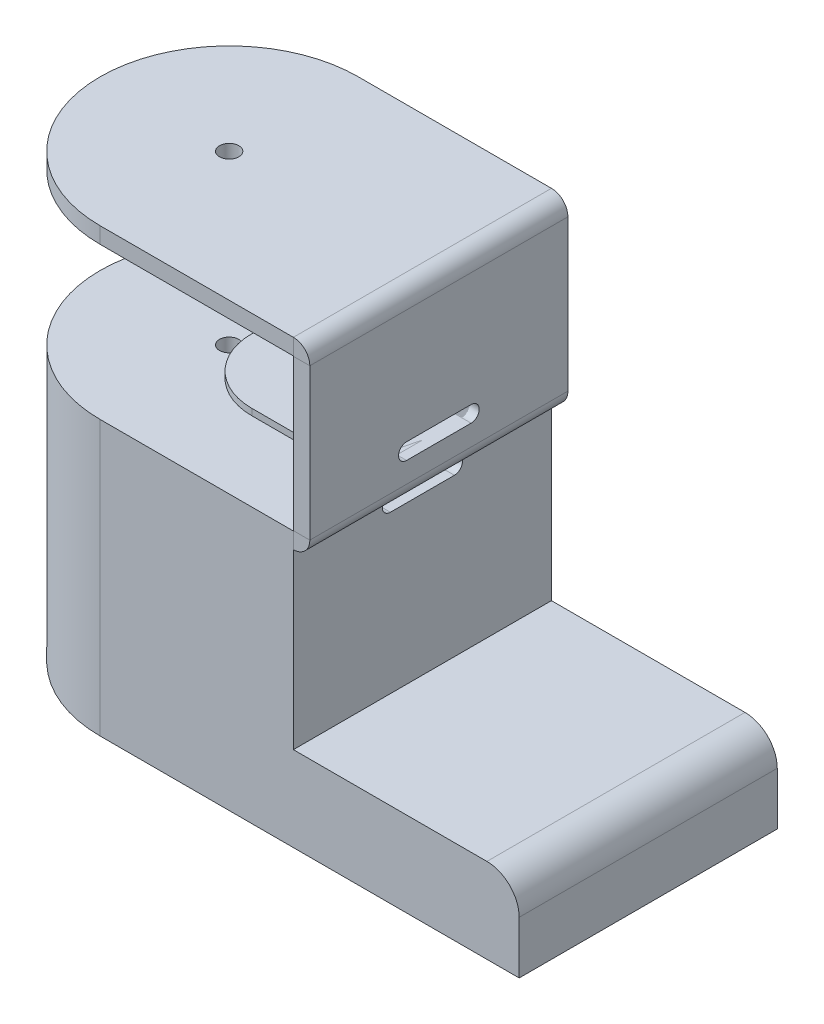
from build123d import *

# Parameters (mm, degrees)
BASE_FLANGE1_DEPTH      = 40
BASE_FLANGE2_DEPTH      = 20
FILLET1_R               = 20
FILLET2_R               = 40
SKETCH10_R              = 3
CUT_EXTRUDE1_DEPTH      = 122.856472951
CUT_EXTRUDE2_DEPTH      = 117.726175299
CUT_EXTRUDE2_DEPTH_BACK = 117.726175299
SKETCH13_R              = 5
EXTRUDE_THIN1_DEPTH     = 80
SKETCH15_R              = 1
CUT_EXTRUDE3_DEPTH      = 5
CUT_EXTRUDE4_START      = -11.1
CUT_EXTRUDE4_DEPTH      = 6
CUT_EXTRUDE4_START_2    = -5
CUT_EXTRUDE4_2_DEPTH    = 5
SKETCH18_W              = 68
SKETCH18_H              = 20
CUT_EXTRUDE5_DEPTH      = 6
BOSS_EXTRUDE1_DEPTH     = 70
SKETCH20_W              = 6
SKETCH20_H              = 68
BOSS_EXTRUDE2_DEPTH     = 20
FILLET3_R               = 10


# Read off the part's stored shape, not the designer's step: Cut-Extrude4
# Sheet-metal steps are written as plain solids
with BuildPart() as part:
    # Sketch2 → Base-Flange1 (new, symmetric)
    with BuildSketch(Plane.XY):
        with BuildLine():
            Line((-100, 47), (-0.1, 47))
            ThreePointArc((-0.1, 47), (-0.029289322, 46.970710678), (0, 46.9))
            Line((0, 46.9), (0, 0.1))
            ThreePointArc((0, 0.1), (-0.029289322, 0.029289322), (-0.1, 0))
            Line((-0.1, 0), (-100, 0))
            Line((-100, 0), (-100, -5))
            Line((-100, -5), (-0.1, -5))
            ThreePointArc((-0.1, -5), (3.506244584, -3.506244584), (5, 0.1))
            Line((5, 0.1), (5, 46.9))
            ThreePointArc((5, 46.9), (3.506244584, 50.506244584), (-0.1, 52))
            Line((-0.1, 52), (-100, 52))
            Line((-100, 52), (-100, 47))
        make_face()
    extrude(amount=BASE_FLANGE1_DEPTH, both=True)

    # Fillet2
    fillet2_edges = [part.edges().sort_by_distance(p)[0] for p in [
        (-100, -2.5, 40),
        (-100, -2.5, -40),
        (-100, 49.5, -40),
        (-100, 49.5, 40),
    ]]
    fillet(fillet2_edges, radius=FILLET2_R - 0.0001)  # a hair under: the kernel refuses the full size

    # Sketch10 → Cut-Extrude1 (cut, through all)
    with BuildSketch(Plane(origin=(0, 52, 0), x_dir=(1, 0, 0), z_dir=(0, 1, 0))):
        with Locations(Location((-60, 0, 0), (0, 0, 180))):
            Circle(SKETCH10_R)
    extrude(amount=-CUT_EXTRUDE1_DEPTH, mode=Mode.SUBTRACT)

    # Sketch14 → Extrude-Thin1 (add)
    with BuildSketch(Plane.XZ.offset(5)):
        with BuildLine():
            Line((-60, 40), (-0.1, 40))
            Line((-0.1, 40), (-0.1, -40))
            Line((-0.1, -40), (-60, -40))
            ThreePointArc((-60, -40), (-100, 0), (-60, 40))
        make_face()
        with BuildLine():
            Line((-60, 34), (-6.1, 34))
            Line((-6.1, 34), (-6.1, -34))
            Line((-6.1, -34), (-60, -34))
            ThreePointArc((-60, -34), (-94, 0), (-60, 34))
        make_face(mode=Mode.SUBTRACT)
    extrude(amount=EXTRUDE_THIN1_DEPTH)

    # Sketch15 → Cut-Extrude3 (cut)
    with BuildSketch(Plane(origin=(0, 0, 0), x_dir=(1, 0, 0), z_dir=(0, 1, 0))):
        with Locations(Location((-33, 0, 0), (0, 0, 180))):
            Circle(SKETCH15_R)
    extrude(amount=-CUT_EXTRUDE3_DEPTH, mode=Mode.SUBTRACT)

    # Cut-Extrude4 outline → Cut-Extrude4 (cut)
    with BuildSketch(Plane(origin=(5, 0, 0), x_dir=(0, 0, -1), z_dir=(1, 0, 0)).offset(CUT_EXTRUDE4_START)):
        with BuildLine():
            ThreePointArc((-9.925361454, -5), (-12.425361454, -7.5), (-9.925361454, -10))
            Line((-9.925361454, -10), (9.925361454, -10))
            ThreePointArc((9.925361454, -10), (12.425361454, -7.5), (9.925361454, -5))
            Line((9.925361454, -5), (-9.925361454, -5))
        make_face()
    extrude(amount=CUT_EXTRUDE4_DEPTH, mode=Mode.SUBTRACT)


with BuildPart() as body_2:
    # Sketch7 → Base-Flange2 (new, symmetric)
    with BuildSketch(Plane.XY):
        with BuildLine():
            Line((-53, 6.5), (-0.1, 6.5))
            ThreePointArc((-0.1, 6.5), (-0.029289322, 6.529289322), (0, 6.6))
            Line((0, 6.6), (0, 39.9))
            ThreePointArc((0, 39.9), (-0.029289322, 39.970710678), (-0.1, 40))
            Line((-0.1, 40), (-53, 40))
            Line((-53, 40), (-53, 42))
            Line((-53, 42), (-0.1, 42))
            ThreePointArc((-0.1, 42), (1.38492424, 41.38492424), (2, 39.9))
            Line((2, 39.9), (2, 6.6))
            ThreePointArc((2, 6.6), (1.38492424, 5.11507576), (-0.1, 4.5))
            Line((-0.1, 4.5), (-53, 4.5))
            Line((-53, 4.5), (-53, 6.5))
        make_face()
    extrude(amount=BASE_FLANGE2_DEPTH, both=True)

    # Fillet1
    fillet1_edges = [body_2.edges().sort_by_distance(p)[0] for p in [
        (-53, 5.5, -20),
        (-53, 5.5, 20),
        (-53, 41, 20),
        (-53, 41, -20),
    ]]
    fillet(fillet1_edges, radius=FILLET1_R - 0.0001)  # a hair under: the kernel refuses the full size

    # Sketch13 → Cut-Extrude2 (cut, two sides: drawn at the far end of the back side and taken through both)
    with BuildSketch(Plane.XZ.offset(-40).offset(-CUT_EXTRUDE2_DEPTH_BACK)):
        with Locations(Location((-33, 0, 0), (0, 0, 90))):
            Circle(SKETCH13_R)
    extrude(amount=CUT_EXTRUDE2_DEPTH + CUT_EXTRUDE2_DEPTH_BACK, mode=Mode.SUBTRACT)


with BuildPart() as cut_extrude4_2_tool:
    # Cut-Extrude4 2 outline → Cut-Extrude4 2 (new body)
    with BuildSketch(Plane(origin=(5, 0, 0), x_dir=(0, 0, -1), z_dir=(1, 0, 0)).offset(CUT_EXTRUDE4_START_2)):
        with BuildLine():
            ThreePointArc((-10, 11.5), (-12.5, 9), (-10, 6.5))
            Line((-10, 6.5), (10, 6.5))
            ThreePointArc((10, 6.5), (12.5, 9), (10, 11.5))
            Line((10, 11.5), (-10, 11.5))
        make_face()
    extrude(amount=CUT_EXTRUDE4_2_DEPTH)


with BuildPart() as part_1:
    add(part.part)

    # Cut-Extrude4 2: cut by cut_extrude4_2_tool
    add(cut_extrude4_2_tool.part, mode=Mode.SUBTRACT)

    # Sketch18 → Cut-Extrude5 (cut)
    with BuildSketch(Plane(origin=(-0.1, 0, 0), x_dir=(0, 0, -1), z_dir=(1, 0, 0))):
        with Locations((0, -75)):
            Rectangle(SKETCH18_W, SKETCH18_H)
    extrude(amount=-CUT_EXTRUDE5_DEPTH, mode=Mode.SUBTRACT)

    # Sketch19 → Boss-Extrude1 (add)
    with BuildSketch(Plane(origin=(-0.1, 0, 0), x_dir=(0, 0, -1), z_dir=(1, 0, 0))):
        Polygon((-34, -85), (-40, -85), (-40, -58.699138256), (40, -58.699138256), (40, -85), (34, -85), (34, -65), (-34, -65), align=None)
    extrude(amount=BOSS_EXTRUDE1_DEPTH)

    # Sketch20 → Boss-Extrude2 (add)
    with BuildSketch(Plane.XZ.offset(65)):
        with Locations((66.9, 0)):
            Rectangle(SKETCH20_W, SKETCH20_H)
    extrude(amount=BOSS_EXTRUDE2_DEPTH)

    # Fillet3
    fillet3_edges = [part_1.edges().sort_by_distance(p)[0] for p in [
        (69.9, -58.699138256, 0),
        (63.9, -65, 0),
    ]]
    fillet(fillet3_edges, radius=FILLET3_R)


with BuildPart() as body_2_1:
    add(body_2.part)

    # Cut-Extrude4 2: cut by cut_extrude4_2_tool
    add(cut_extrude4_2_tool.part, mode=Mode.SUBTRACT)


solid = Compound([part_1.part, body_2_1.part])
